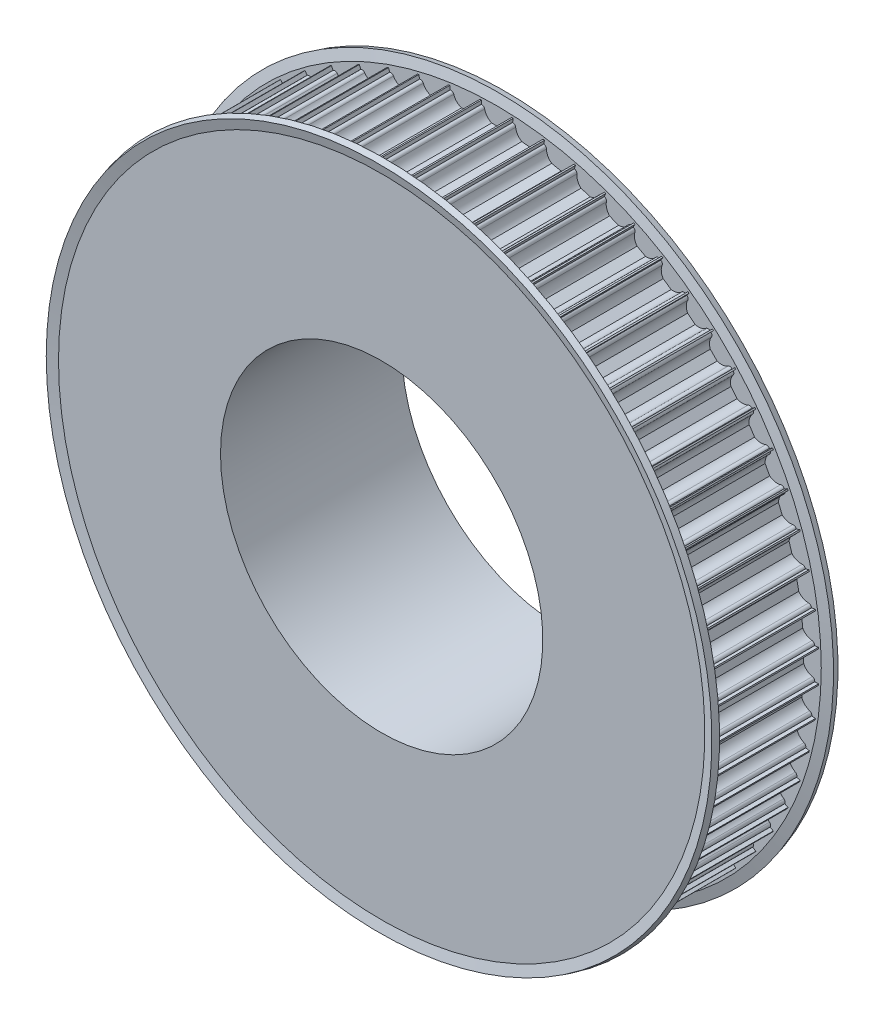
from build123d import *

# Parameters (mm, degrees)
CUT_EXTRUDE1_DEPTH = 122.757956619
CIRPATTERN1_COUNT  = 64


with BuildPart() as part:
    # Sketch1 → Revolve1 (revolve)
    with BuildSketch(Plane(origin=(0, 0, 0), x_dir=(0, 0, -1), z_dir=(1, 0, 0))):
        Polygon((0, 40), (0, 80), (30, 80), (30, 55.5), (45, 55.5), (45, 40), align=None)
    revolve(axis=Axis((0, 0, -88.99), (0, 0, 1)))

    # Sketch2 → Cut-Extrude1 (cut, through all)
    with BuildSketch(Plane.XY):
        with BuildLine():
            Line((3.674234614, 79), (3.75, 79))
            Line((3.75, 79), (3.75, 81))
            Line((3.75, 81), (-3.75, 81))
            Line((-3.75, 81), (-3.75, 79))
            Line((-3.75, 79), (-3.674234614, 79))
            ThreePointArc((-3.674234614, 79), (-3.199892965, 78.830947502), (-2.939387691, 78.4))
            ThreePointArc((-2.939387691, 78.4), (-2.331759211, 77.112435701), (-1.198957881, 76.25))
            Line((-1.198957881, 76.25), (1.198957881, 76.25))
            ThreePointArc((1.198957881, 76.25), (2.331759211, 77.112435701), (2.939387691, 78.4))
            ThreePointArc((2.939387691, 78.4), (3.199892965, 78.830947502), (3.674234614, 79))
        make_face()
    cut_extrude1 = extrude(amount=-CUT_EXTRUDE1_DEPTH, mode=Mode.SUBTRACT)

    # CirPattern1: Cut-Extrude1 ×64 about axis
    cirpattern1_axis = Axis((0, 0, -88.99), (0, 0, 1))
    for i in range(1, CIRPATTERN1_COUNT):
        add(cut_extrude1.rotate(cirpattern1_axis, i * 360 / CIRPATTERN1_COUNT), mode=Mode.SUBTRACT)

    # Sketch3 → Revolve2 (revolve)
    with BuildSketch(Plane(origin=(0, 0, 0), x_dir=(0, 0, -1), z_dir=(1, 0, 0))):
        Polygon((-0.643078062, 82.610137253), (0, 80.210137253), (0, 75.612061042), (1.5, 75.612061042), (1.5, 80.612061042), (0.856921938, 83.012061042), align=None)
        Polygon((30.643078062, 82.610137253), (29.143078062, 83.012061042), (28.5, 80.612061042), (28.5, 75.612061042), (30, 75.612061042), (30, 80.210137253), align=None)
    revolve(axis=Axis((0, 0, -88.99), (0, 0, 1)))


solid = part.part
